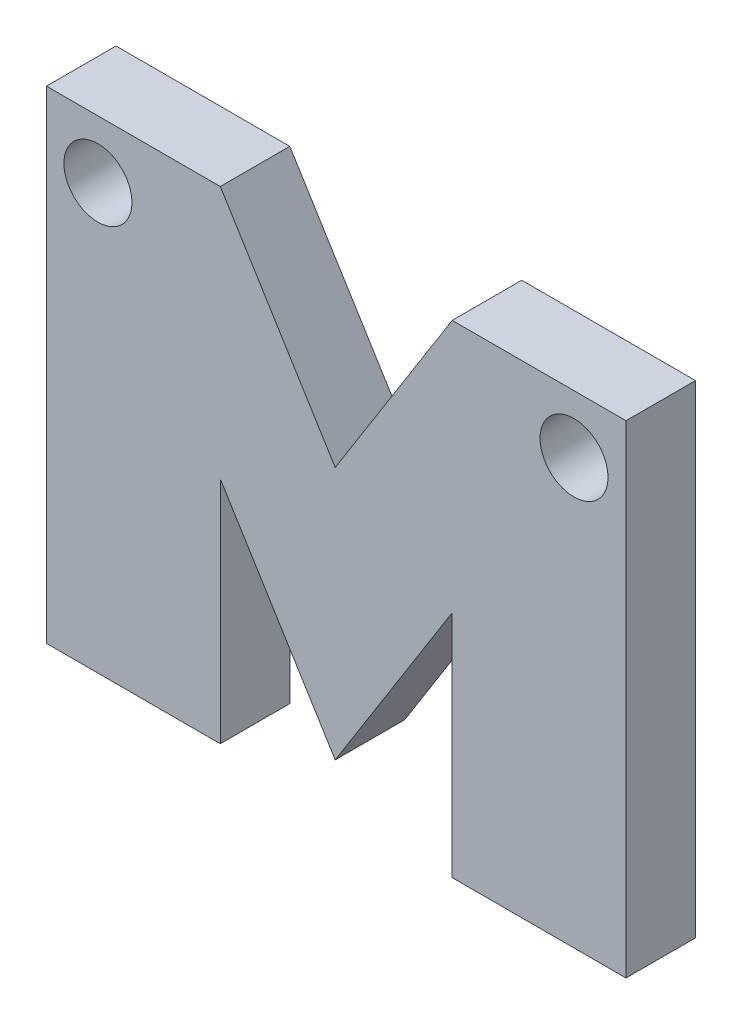
from build123d import *

# Parameters (mm, degrees)
BOSS_EXTRUDE2_DEPTH = 12.7
SKETCH3_R           = 6.21018305
CUT_EXTRUDE1_DEPTH  = 12.7


with BuildPart() as part:
    # Sketch2 → Boss-Extrude2 (new body)
    with BuildSketch(Plane.XY):
        Polygon((-95.018058553, 49.23852459), (-126.768058553, 49.23852459), (-126.768058553, -38.932786885), (-95.018058553, -38.932786885), (-95.018058553, 2.984153005), (-74.024889154, -30.986612022), (-52.650025766, 2.984153005), (-52.650025766, -38.932786885), (-20.900025766, -38.932786885), (-20.900025766, 49.23852459), (-52.650025766, 49.23852459), (-74.024889154, 15.267759563), align=None)
    extrude(amount=BOSS_EXTRUDE2_DEPTH)

    # Sketch3 → Cut-Extrude1 (cut)
    with BuildSketch(Plane(origin=(0, 0, 0), x_dir=(-1, 0, 0), z_dir=(0, 0, -1))):
        with Locations((30.393684486, 38.628446223)):
            Circle(SKETCH3_R)
        with Locations((117.370058553, 38.628446223)):
            Circle(SKETCH3_R)
    extrude(amount=-CUT_EXTRUDE1_DEPTH, mode=Mode.SUBTRACT)


solid = part.part
